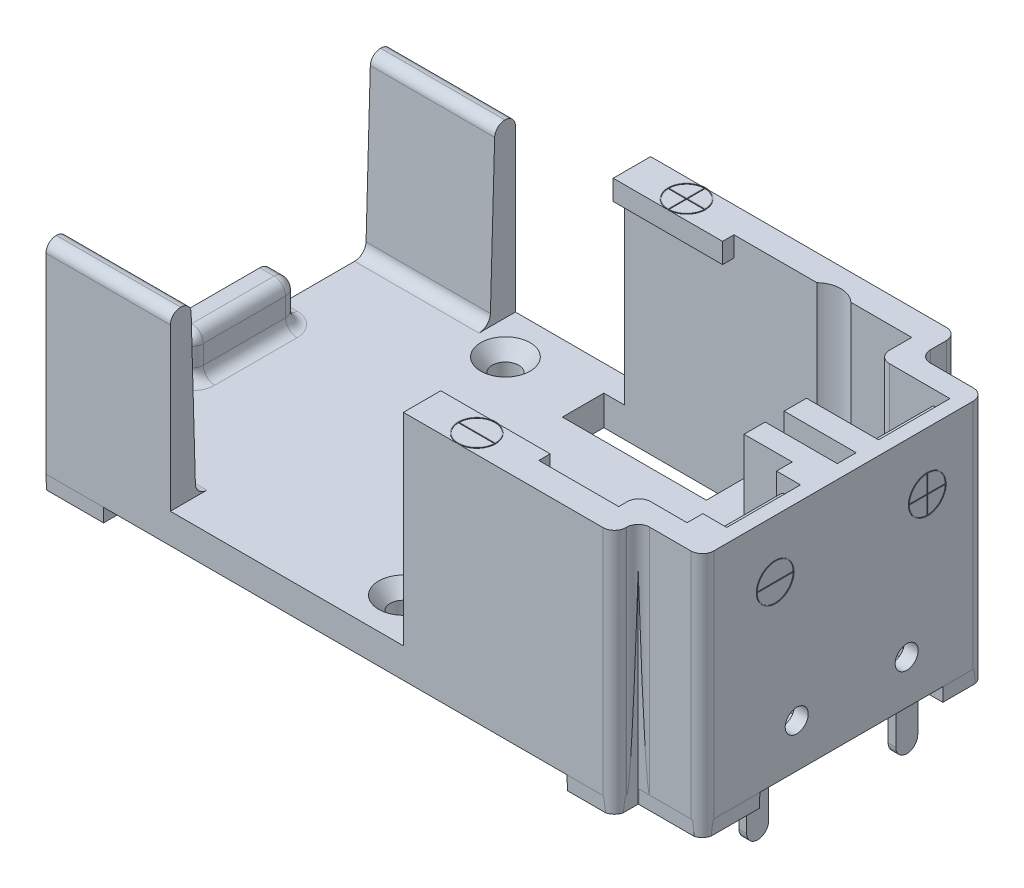
from build123d import *

# Parameters (mm, degrees)
SKETCH1_W                     = 54.94
SKETCH1_H                     = 29.97
BOSS_EXTRUDE1_DEPTH           = 20.16
SKETCH2_W                     = 5.72
SKETCH2_H                     = 3.38
SKETCH2_W_2                   = 5.57
SKETCH2_H_2                   = 2.060299425
CUT_EXTRUDE1_DEPTH            = 17.56
SKETCH6_W                     = 5.72
SKETCH6_H                     = 3.38
SKETCH6_W_2                   = 5.57
SKETCH6_H_2                   = 2.060299425
CUT_EXTRUDE3_DEPTH            = 36.881816077
BOSS_EXTRUDE5_DEPTH           = 1.2
BOSS_EXTRUDE5_DRAFT           = 1
BOSS_EXTRUDE5_PROFILE_2_DEPTH = 1.2
BOSS_EXTRUDE5_PROFILE_2_DRAFT = 1
BOSS_EXTRUDE5_PROFILE_3_DEPTH = 1.2
BOSS_EXTRUDE5_PROFILE_3_DRAFT = 1
BOSS_EXTRUDE5_PROFILE_4_DEPTH = 1.2
BOSS_EXTRUDE5_PROFILE_4_DRAFT = 1
SKETCH4_R                     = 1.9
BOSS_EXTRUDE5_PROFILE_5_DEPTH = 1.2
BOSS_EXTRUDE5_PROFILE_5_DRAFT = 1
BOSS_EXTRUDE5_PROFILE_6_DEPTH = 1.2
BOSS_EXTRUDE5_PROFILE_6_DRAFT = 1
BOSS_EXTRUDE5_PROFILE_7_DEPTH = 1.2
BOSS_EXTRUDE5_PROFILE_7_DRAFT = 1
SKETCH5_W                     = 12.5
SKETCH5_H                     = 3.6
CUT_EXTRUDE4_DEPTH            = 36.881816077
SKETCH7_W                     = 9.5
SKETCH7_H                     = 3.25
BOSS_EXTRUDE6_DEPTH           = 1.75
SKETCH8_R                     = 1.145
CUT_EXTRUDE5_DEPTH            = 38.886682687
SKETCH10_R                    = 2.14
CUT_EXTRUDE7_DEPTH            = 17.56
CHAMFER1_SIZE                 = 1
CHAMFER1_SIZE_2               = 1.191753593
BOSS_EXTRUDE7_DEPTH           = 10.8
BOSS_EXTRUDE8_DEPTH           = 2.25
FILLET1_R                     = 1
FILLET2_R                     = 1
CUT_EXTRUDE8_REACH            = 62.41
SKETCH13_R                    = 1
BOSS_EXTRUDE9_DEPTH           = 2.95
LPATTERN1_COUNT               = 2
LPATTERN1_PITCH               = 13.1
FILLET3_R                     = 1
SKETCH15_R                    = 1.625
BOSS_EXTRUDE10_DEPTH          = 0.05
SKETCH16_R                    = 1.625
BOSS_EXTRUDE11_DEPTH          = 0.05
CUT_EXTRUDE9_DEPTH            = 0.5
SKETCH18_W                    = 0.66
SKETCH18_H                    = 1.91
BOSS_EXTRUDE12_DEPTH          = 5.08
FILLET4_R                     = 0.95


with BuildPart() as part:
    # Sketch1 → Boss-Extrude1 (new body)
    with BuildSketch(Plane(origin=(0, 0, 0), x_dir=(1, 0, 0), z_dir=(0, 1, 0))):
        Rectangle(SKETCH1_W, SKETCH1_H)
    extrude(amount=BOSS_EXTRUDE1_DEPTH)

    # Sketch2 → Cut-Extrude1 (cut)
    with BuildSketch(Plane(origin=(0, 20.16, 0), x_dir=(1, 0, 0), z_dir=(0, 1, 0))):
        Polygon((24.19, -3.2), (24.19, -1.831765069), (20.01, -1.84), (20.01, 0), (26.27, 0), (26.27, 1.64), (20.01, 1.64), (20.01, 3.58), (26.27, 3.58), (26.27, 9.785), (20.01, 9.785), (20.01, 12.725), (-4.93, 12.725), (-4.93, 14.985), (-27.47, 14.985), (-27.47, -14.985), (3.57, -14.985), (3.57, -12.725), (20.01, -12.725), (20.01, -10.96), (24.19, -10.968234931), (24.19, -9.6), (26.27, -9.6), (26.27, -3.2), align=None)
        with Locations((24.61, 13.295)):
            Rectangle(SKETCH2_W, SKETCH2_H)
        with Locations((24.685, -13.954850288)):
            Rectangle(SKETCH2_W_2, SKETCH2_H_2)
    extrude(amount=-CUT_EXTRUDE1_DEPTH, mode=Mode.SUBTRACT)

    # Sketch6 → Cut-Extrude3 (cut, through all)
    with BuildSketch(Plane(origin=(0, 2.6, 0), x_dir=(1, 0, 0), z_dir=(0, 1, 0))):
        with Locations((24.61, 13.295)):
            Rectangle(SKETCH6_W, SKETCH6_H)
        with Locations((24.685, -13.954850288)):
            Rectangle(SKETCH6_W_2, SKETCH6_H_2)
    extrude(amount=-CUT_EXTRUDE3_DEPTH, mode=Mode.SUBTRACT)


with BuildPart() as boss_extrude5_tool:
    # Sketch4 → Boss-Extrude5 (with draft: the straight prism first)
    with BuildSketch(Plane.XZ):
        Polygon((20.750835959, 13.735), (20.750835959, 11.674700575), (26.22, 11.674700575), (26.22, 7.924700575), (27.47, 7.924700575), (27.47, 12.913827385), (21.950835959, 12.913827385), (21.950835959, 12.924700575), (21.9, 12.924700575), (21.9, 14.985), (17.778708036, 14.985), (17.778708036, 13.735), align=None)
    extrude(amount=BOSS_EXTRUDE5_DEPTH)
    # Boss-Extrude5: the draft: its side faces are tilted about the plane it starts from
    boss_extrude5_sides = [boss_extrude5_tool.faces().sort_by_distance(p)[0] for p in [
        (20.750835959, -0.6, 12.704850288),
        (23.485417979, -0.6, 11.674700575),
        (26.22, -0.6, 9.799700575),
        (26.845, -0.6, 7.924700575),
        (27.47, -0.6, 10.41926398),
        (24.710417979, -0.6, 12.913827385),
        (21.950835959, -0.6, 12.91926398),
        (21.925417979, -0.6, 12.924700575),
        (21.9, -0.6, 13.954850288),
        (19.839354018, -0.6, 14.985),
        (17.778708036, -0.6, 14.36),
        (19.264771997, -0.6, 13.735),
    ]]
    draft(boss_extrude5_sides, Plane.XZ, BOSS_EXTRUDE5_DRAFT)


with BuildPart() as part_1:
    add(part.part)

    # Boss-Extrude5: add boss_extrude5_tool
    add(boss_extrude5_tool.part)


with BuildPart() as boss_extrude5_profile_2_tool:
    # Sketch4 → Boss-Extrude5 profile 2 (with draft: the straight prism first)
    with BuildSketch(Plane.XZ):
        Polygon((-22.47, 13.735), (-22.47, 14.985), (-27.47, 14.985), (-27.47, 9.985), (-26.22, 9.985), (-26.22, 13.735), align=None)
    extrude(amount=BOSS_EXTRUDE5_PROFILE_2_DEPTH)
    # Boss-Extrude5 profile 2: the draft: its side faces are tilted about the plane it starts from
    boss_extrude5_profile_2_sides = [boss_extrude5_profile_2_tool.faces().sort_by_distance(p)[0] for p in [
        (-22.47, -0.6, 14.36),
        (-24.97, -0.6, 14.985),
        (-27.47, -0.6, 12.485),
        (-26.845, -0.6, 9.985),
        (-26.22, -0.6, 11.86),
        (-24.345, -0.6, 13.735),
    ]]
    draft(boss_extrude5_profile_2_sides, Plane.XZ, BOSS_EXTRUDE5_PROFILE_2_DRAFT)


with BuildPart() as part_2:
    add(part_1.part)

    # Boss-Extrude5 profile 2: add boss_extrude5_profile_2_tool
    add(boss_extrude5_profile_2_tool.part)


with BuildPart() as boss_extrude5_profile_3_tool:
    # Sketch4 → Boss-Extrude5 profile 3 (with draft: the straight prism first)
    with BuildSketch(Plane.XZ):
        Polygon((27.47, -11.605), (27.47, -7.964577097), (26.22, -7.964577097), (26.22, -10.405), (20.55, -10.405), (20.55, -13.735), (17.778708036, -13.735), (17.778708036, -14.985), (21.75, -14.985), (21.75, -11.605), align=None)
    extrude(amount=BOSS_EXTRUDE5_PROFILE_3_DEPTH)
    # Boss-Extrude5 profile 3: the draft: its side faces are tilted about the plane it starts from
    boss_extrude5_profile_3_sides = [boss_extrude5_profile_3_tool.faces().sort_by_distance(p)[0] for p in [
        (27.47, -0.6, -9.784788548),
        (26.845, -0.6, -7.964577097),
        (26.22, -0.6, -9.184788548),
        (23.385, -0.6, -10.405),
        (20.55, -0.6, -12.07),
        (19.164354018, -0.6, -13.735),
        (17.778708036, -0.6, -14.36),
        (19.764354018, -0.6, -14.985),
        (21.75, -0.6, -13.295),
        (24.61, -0.6, -11.605),
    ]]
    draft(boss_extrude5_profile_3_sides, Plane.XZ, BOSS_EXTRUDE5_PROFILE_3_DRAFT)


with BuildPart() as part_3:
    add(part_2.part)

    # Boss-Extrude5 profile 3: add boss_extrude5_profile_3_tool
    add(boss_extrude5_profile_3_tool.part)


with BuildPart() as boss_extrude5_profile_4_tool:
    # Sketch4 → Boss-Extrude5 profile 4 (with draft: the straight prism first)
    with BuildSketch(Plane.XZ):
        Polygon((-22.47, -14.985), (-22.47, -13.735), (-26.22, -13.735), (-26.22, -9.985), (-27.47, -9.985), (-27.47, -14.985), align=None)
    extrude(amount=BOSS_EXTRUDE5_PROFILE_4_DEPTH)
    # Boss-Extrude5 profile 4: the draft: its side faces are tilted about the plane it starts from
    boss_extrude5_profile_4_sides = [boss_extrude5_profile_4_tool.faces().sort_by_distance(p)[0] for p in [
        (-22.47, -0.6, -14.36),
        (-24.345, -0.6, -13.735),
        (-26.22, -0.6, -11.86),
        (-26.845, -0.6, -9.985),
        (-27.47, -0.6, -12.485),
        (-24.97, -0.6, -14.985),
    ]]
    draft(boss_extrude5_profile_4_sides, Plane.XZ, BOSS_EXTRUDE5_PROFILE_4_DRAFT)


with BuildPart() as part_4:
    add(part_3.part)

    # Boss-Extrude5 profile 4: add boss_extrude5_profile_4_tool
    add(boss_extrude5_profile_4_tool.part)


with BuildPart() as boss_extrude5_profile_5_tool:
    # Sketch4 → Boss-Extrude5 profile 5 (with draft: the straight prism first)
    with BuildSketch(Plane.XZ):
        with Locations((-0.24, 11.175)):
            Circle(SKETCH4_R)
    extrude(amount=BOSS_EXTRUDE5_PROFILE_5_DEPTH)
    # Boss-Extrude5 profile 5: the draft: its side faces are tilted about the plane it starts from
    boss_extrude5_profile_5_sides = [boss_extrude5_profile_5_tool.faces().sort_by_distance(p)[0] for p in [
        (-2.14, -0.6, 11.175),
    ]]
    draft(boss_extrude5_profile_5_sides, Plane.XZ, BOSS_EXTRUDE5_PROFILE_5_DRAFT)


with BuildPart() as part_5:
    add(part_4.part)

    # Boss-Extrude5 profile 5: add boss_extrude5_profile_5_tool
    add(boss_extrude5_profile_5_tool.part)


with BuildPart() as boss_extrude5_profile_6_tool:
    # Sketch4 → Boss-Extrude5 profile 6 (with draft: the straight prism first)
    with BuildSketch(Plane.XZ):
        with Locations((-13.7274, -11.175)):
            Circle(SKETCH4_R)
    extrude(amount=BOSS_EXTRUDE5_PROFILE_6_DEPTH)
    # Boss-Extrude5 profile 6: the draft: its side faces are tilted about the plane it starts from
    boss_extrude5_profile_6_sides = [boss_extrude5_profile_6_tool.faces().sort_by_distance(p)[0] for p in [
        (-15.6274, -0.6, -11.175),
    ]]
    draft(boss_extrude5_profile_6_sides, Plane.XZ, BOSS_EXTRUDE5_PROFILE_6_DRAFT)


with BuildPart() as part_6:
    add(part_5.part)

    # Boss-Extrude5 profile 6: add boss_extrude5_profile_6_tool
    add(boss_extrude5_profile_6_tool.part)


with BuildPart() as boss_extrude5_profile_7_tool:
    # Sketch4 → Boss-Extrude5 profile 7 (with draft: the straight prism first)
    with BuildSketch(Plane.XZ):
        with Locations((13.2474, -11.175)):
            Circle(SKETCH4_R)
    extrude(amount=BOSS_EXTRUDE5_PROFILE_7_DEPTH)
    # Boss-Extrude5 profile 7: the draft: its side faces are tilted about the plane it starts from
    boss_extrude5_profile_7_sides = [boss_extrude5_profile_7_tool.faces().sort_by_distance(p)[0] for p in [
        (11.3474, -0.6, -11.175),
    ]]
    draft(boss_extrude5_profile_7_sides, Plane.XZ, BOSS_EXTRUDE5_PROFILE_7_DRAFT)


with BuildPart() as part_7:
    add(part_6.part)

    # Boss-Extrude5 profile 7: add boss_extrude5_profile_7_tool
    add(boss_extrude5_profile_7_tool.part)

    # Sketch5 → Cut-Extrude4 (cut, through all)
    with BuildSketch(Plane(origin=(0, 2.6, 0), x_dir=(1, 0, 0), z_dir=(0, 1, 0))):
        with Locations((8.82, -10.925)):
            Rectangle(SKETCH5_W, SKETCH5_H)
        with Locations((-0.48, 10.925)):
            Rectangle(SKETCH5_W, SKETCH5_H)
    extrude(amount=-CUT_EXTRUDE4_DEPTH, mode=Mode.SUBTRACT)

    # Sketch7 → Boss-Extrude6 (add)
    with BuildSketch(Plane(origin=(0, 20.16, 0), x_dir=(1, 0, 0), z_dir=(0, 1, 0))):
        with Locations((-0.18, 13.36)):
            Rectangle(SKETCH7_W, SKETCH7_H)
        with Locations((8.32, -13.36)):
            Rectangle(SKETCH7_W, SKETCH7_H)
    extrude(amount=-BOSS_EXTRUDE6_DEPTH)

    # Sketch8 → Cut-Extrude5 (cut, through all)
    with BuildSketch(Plane.XZ.offset(1.2)):
        with Locations(Location((-0.24, 11.175, 0), (0, 0, 270))):
            Circle(SKETCH8_R)
        with Locations(Location((-13.7274, -11.175, 0), (0, 0, 270))):
            Circle(SKETCH8_R)
        with Locations(Location((13.2474, -11.175, 0), (0, 0, 270))):
            Circle(SKETCH8_R)
    extrude(amount=-CUT_EXTRUDE5_DEPTH, mode=Mode.SUBTRACT)

    # Sketch10 → Cut-Extrude7 (cut)
    with BuildSketch(Plane(origin=(0, 20.16, 0), x_dir=(1, 0, 0), z_dir=(0, 1, 0))):
        with Locations((13.2474, 11.175)):
            Circle(SKETCH10_R)
    extrude(amount=-CUT_EXTRUDE7_DEPTH, mode=Mode.SUBTRACT)

    # Chamfer1
    # the kernel refuses this chamfer: 1.191753593, 1 mm, written as the material it takes off along each edge
    with BuildSketch(Plane(origin=(-0.24, 2.6, 11.175), x_dir=(0, 0, -1), z_dir=(-1, 0, 0))) as chamfer1_piece_1:
        Polygon((1.145 + CHAMFER1_SIZE, 0), (1.145, CHAMFER1_SIZE_2), (1.145, 0), align=None)
    revolve(axis=Axis((-0.24, 2.6, 11.175), (0, -1, 0)), mode=Mode.SUBTRACT)
    with BuildSketch(Plane(origin=(13.2474, 2.6, -11.175), x_dir=(0, 0, -1), z_dir=(-1, 0, 0))) as chamfer1_piece_2_section:
        Polygon((1.145 + CHAMFER1_SIZE, 0), (1.145, CHAMFER1_SIZE_2), (1.145, 0), align=None)
    chamfer1_piece_2 = revolve(axis=Axis((13.2474, 2.6, -11.175), (0, -1, 0)), mode=Mode.PRIVATE)
    chamfer1_piece_2 = chamfer1_piece_2 & Plane(origin=(13.2474, 2.401026387, -11.175), x_dir=(1, 0, 0), z_dir=(0, 1, 0)) * Cylinder(2.14, 9, mode=Mode.PRIVATE)
    add(chamfer1_piece_2, mode=Mode.SUBTRACT)
    with BuildSketch(Plane(origin=(13.2474, 2.6, -11.175), x_dir=(0, 0, -1), z_dir=(-1, 0, 0))) as chamfer1_piece_3_section:
        Polygon((1.145 + CHAMFER1_SIZE, 0), (1.145, CHAMFER1_SIZE_2), (1.145, 0), align=None)
    chamfer1_piece_3 = revolve(axis=Axis((13.2474, 2.6, -11.175), (0, -1, 0)), mode=Mode.PRIVATE)
    chamfer1_piece_3 = split(chamfer1_piece_3, bisect_by=Plane(origin=(13.2474, 2.59813433, -12.725), z_dir=(0, 0, 1)), keep=Keep.TOP, mode=Mode.PRIVATE)
    add(chamfer1_piece_3, mode=Mode.SUBTRACT)
    with BuildSketch(Plane(origin=(-13.7274, 2.6, -11.175), x_dir=(0, 0, -1), z_dir=(-1, 0, 0))) as chamfer1_piece_4:
        Polygon((1.145 + CHAMFER1_SIZE, 0), (1.145, CHAMFER1_SIZE_2), (1.145, 0), align=None)
    revolve(axis=Axis((-13.7274, 2.6, -11.175), (0, -1, 0)), mode=Mode.SUBTRACT)

    # Sketch11 → Boss-Extrude7 (add)
    with BuildSketch(Plane.ZY.offset(27.47)):
        with BuildLine():
            Line((-14.985, 2.6), (-14.985, 16.61))
            ThreePointArc((-14.985, 16.61), (-14.724325035, 17.239325035), (-14.095, 17.5))
            Line((-14.095, 17.5), (-14.069847726, 17.5))
            ThreePointArc((-14.069847726, 17.5), (-13.449442694, 17.248120362), (-13.180200347, 16.635050779))
            Line((-13.180200347, 16.635050779), (-12.785, 2.6))
            Line((-12.785, 2.6), (-14.985, 2.6))
        make_face()
        with BuildLine():
            Line((14.985, 2.6), (14.985, 16.61))
            ThreePointArc((14.985, 16.61), (14.724325035, 17.239325035), (14.095, 17.5))
            Line((14.095, 17.5), (14.069847726, 17.5))
            ThreePointArc((14.069847726, 17.5), (13.449442694, 17.248120362), (13.180200347, 16.635050779))
            Line((13.180200347, 16.635050779), (12.785, 2.6))
            Line((12.785, 2.6), (14.985, 2.6))
        make_face()
    extrude(amount=-BOSS_EXTRUDE7_DEPTH)

    # Sketch12 → Boss-Extrude8 (add)
    with BuildSketch(Plane.ZY.offset(27.47)):
        Polygon((4.575, 2.6), (4.575, 6.23), (-4.575, 6.23), (-4.575, 2.6), (0, 2.6), align=None)
    extrude(amount=-BOSS_EXTRUDE8_DEPTH)

    # Fillet1
    fillet1_edges = [part_7.edges().sort_by_distance(p)[0] for p in [
        (-25.22, 6.23, 0),
        (-26.345, 6.23, -4.575),
        (-25.22, 4.415, 4.575),
        (-26.345, 6.23, 4.575),
        (-25.22, 2.6, 0),
        (-26.345, 2.6, 4.575),
        (-25.22, 4.415, -4.575),
        (-26.345, 2.6, -4.575),
    ]]
    fillet(fillet1_edges, radius=FILLET1_R)

    # Fillet2
    fillet2_edges = [part_7.edges().sort_by_distance(p)[0] for p in [
        (-22.07, 2.6, -12.785),
        (-22.07, 2.6, 12.785),
    ]]
    fillet(fillet2_edges, radius=FILLET2_R)

    # Sketch13 → Cut-Extrude8 (cut, up to next)
    with BuildSketch(Plane(origin=(27.47, 0, 0), x_dir=(0, 0, -1), z_dir=(1, 0, 0)), mode=Mode.PRIVATE) as cut_extrude8_sk1:
        with Locations((-4.724700575, 3.8)):
            Circle(SKETCH13_R)
    cut_extrude8_tool1 = extrude(cut_extrude8_sk1.sketch, amount=-CUT_EXTRUDE8_REACH, mode=Mode.PRIVATE) & part_7.part
    # Sketch13 → Cut-Extrude8 (cut, up to next)
    with BuildSketch(Plane(origin=(27.47, 0, 0), x_dir=(0, 0, -1), z_dir=(1, 0, 0)), mode=Mode.PRIVATE) as cut_extrude8_sk2:
        with Locations((4.825299425, 3.8)):
            Circle(SKETCH13_R)
    cut_extrude8_tool2 = extrude(cut_extrude8_sk2.sketch, amount=-CUT_EXTRUDE8_REACH, mode=Mode.PRIVATE) & part_7.part
    add(cut_extrude8_tool1.solids().sort_by_distance((27.47, 3.8, 4.724701))[0], mode=Mode.SUBTRACT)
    add(cut_extrude8_tool2.solids().sort_by_distance((27.47, 3.8, -4.825299))[0], mode=Mode.SUBTRACT)

    # Sketch14 → Boss-Extrude9 (add, symmetric)
    with BuildSketch(Plane.XY.offset(6.4)):
        with BuildLine():
            Line((20.67, 7.01), (20.67, 12.037248807))
            ThreePointArc((20.67, 12.037248807), (20.688913908, 12.173469848), (20.744224688, 12.299385))
            Line((20.744224688, 12.299385), (24.735083596, 18.781546735))
            ThreePointArc((24.735083596, 18.781546735), (24.919175941, 18.977652527), (25.17823832, 19.05))
            Line((25.17823832, 19.05), (25.77, 19.05))
            ThreePointArc((25.77, 19.05), (26.123553391, 18.903553391), (26.27, 18.55))
            Line((26.27, 18.55), (26.27, 0))
            Line((26.27, 0), (25.77, 0))
            Line((25.77, 0), (25.77, 18.55))
            Line((25.77, 18.55), (25.179691855, 18.55))
            Line((25.179691855, 18.55), (21.17, 12.037248807))
            Line((21.17, 12.037248807), (21.17, 7.01))
            Line((21.17, 7.01), (20.67, 7.01))
        make_face()
    boss_extrude9 = extrude(amount=BOSS_EXTRUDE9_DEPTH, both=True)

    # LPattern1: Boss-Extrude9 ×2
    with Locations(*[(0, 0, -i * LPATTERN1_PITCH) for i in range(1, LPATTERN1_COUNT)]):
        add(boss_extrude9)

    # Fillet3
    # the kernel refuses this fillet: 1 mm, written as the material it adds along each edge
    with BuildSketch(Plane(origin=(21.9, 20.16, 12.924700575), x_dir=(1, 0, 0), z_dir=(0, -1, 0))) as fillet3_piece_1_section:
        with BuildLine():
            CenterArc((FILLET3_R, FILLET3_R), FILLET3_R, 180, 90)
            Line((0, FILLET3_R), (0, 0))
            Line((0, 0), (FILLET3_R, 0))
        make_face()
    fillet3_piece_1 = extrude(amount=22.66, mode=Mode.PRIVATE)
    fillet3_piece_1 = split(fillet3_piece_1, bisect_by=Plane(origin=(22.363741496, 10.856251642, 13.114197153), z_dir=(0, 0.017452406437283536, -0.9998476951563913)), keep=Keep.TOP, mode=Mode.PRIVATE)
    add(fillet3_piece_1)
    with BuildSketch(Plane(origin=(21.9, 20.16, 12.924700575), x_dir=(1, 0, 0), z_dir=(0, -1, 0))) as fillet3_piece_2_section:
        with BuildLine():
            CenterArc((FILLET3_R, FILLET3_R), FILLET3_R, 180, 90)
            Line((0, FILLET3_R), (0, 0))
            Line((0, 0), (FILLET3_R, 0))
        make_face()
    fillet3_piece_2 = extrude(amount=22.66, mode=Mode.PRIVATE)
    fillet3_piece_2 = split(fillet3_piece_2, bisect_by=Plane(origin=(22.094636271, 11.150704517, 13.359044936), z_dir=(-0.9998476951563913, 0.017452406437283536, 0)), keep=Keep.TOP, mode=Mode.PRIVATE)
    add(fillet3_piece_2)
    with BuildSketch(Plane(origin=(21.75, -2.5, -11.605), x_dir=(0, 0, -1), z_dir=(0, 1, 0))) as fillet3_piece_3_section:
        with BuildLine():
            CenterArc((FILLET3_R, -FILLET3_R), FILLET3_R, 90, 90)
            Line((0, -FILLET3_R), (0, 0))
            Line((0, 0), (FILLET3_R, 0))
        make_face()
    fillet3_piece_3 = extrude(amount=22.66, mode=Mode.PRIVATE)
    fillet3_piece_3 = split(fillet3_piece_3, bisect_by=Plane(origin=(22.184344361, 11.150704517, -11.799636271), z_dir=(0, 0.017452406437283536, 0.9998476951563913)), keep=Keep.TOP, mode=Mode.PRIVATE)
    add(fillet3_piece_3)
    with BuildSketch(Plane(origin=(21.75, -2.5, -11.605), x_dir=(0, 0, -1), z_dir=(0, 1, 0))) as fillet3_piece_4_section:
        with BuildLine():
            CenterArc((FILLET3_R, -FILLET3_R), FILLET3_R, 90, 90)
            Line((0, -FILLET3_R), (0, 0))
            Line((0, 0), (FILLET3_R, 0))
        make_face()
    fillet3_piece_4 = extrude(amount=22.66, mode=Mode.PRIVATE)
    fillet3_piece_4 = split(fillet3_piece_4, bisect_by=Plane(origin=(21.944636271, 11.150704518, -12.039344361), z_dir=(-0.9998476951563913, 0.017452406437283536, 0)), keep=Keep.TOP, mode=Mode.PRIVATE)
    add(fillet3_piece_4)
    # the kernel refuses this fillet: 1 mm, written as the material it takes off along each edge
    with BuildSketch(Plane(origin=(20.01, 22.66, -9.785), x_dir=(1, 0, 0), z_dir=(0, -1, 0))) as fillet3_2_piece_1:
        with BuildLine():
            CenterArc((FILLET3_R, -FILLET3_R), FILLET3_R, 90, 90)
            Line((0, -FILLET3_R), (0, 0))
            Line((0, 0), (FILLET3_R, 0))
        make_face()
    extrude(amount=20.06, mode=Mode.SUBTRACT)
    with BuildSketch(Plane(origin=(20.01, 22.66493005, 10.96), x_dir=(0, 0, 1), z_dir=(0, -1, 0))) as fillet3_2_piece_2:
        with BuildLine():
            CenterArc((FILLET3_R * 1.00197201985, -FILLET3_R), FILLET3_R, 90, 90.11287708)
            Line((FILLET3_R * 0.00197396045284, -FILLET3_R * 1.00197007542), (0, 0))
            Line((0, 0), (FILLET3_R * 1.00197201985, 0))
        make_face()
    extrude(amount=20.06493005, mode=Mode.SUBTRACT)
    with BuildSketch(Plane(origin=(21.9, 22.66, 14.985), x_dir=(-1, 0, 0), z_dir=(0, -1, 0)), Plane(origin=(21.75, 22.66, -14.985), x_dir=(0, 0, 1), z_dir=(0, -1, 0))) as fillet3_2_piece_3:
        with BuildLine():
            CenterArc((FILLET3_R, FILLET3_R), FILLET3_R, 180, 90)
            Line((0, FILLET3_R), (0, 0))
            Line((0, 0), (FILLET3_R, 0))
        make_face()
    extrude(amount=25.16, mode=Mode.SUBTRACT)
    with BuildSketch(Plane(origin=(27.47, 22.66, 12.924700575), x_dir=(0, 0, -1), z_dir=(0, -1, 0)), Plane(origin=(27.47, -2.5, -11.605), x_dir=(0, 0, 1), z_dir=(0, 1, 0))) as fillet3_2_piece_4:
        with BuildLine():
            CenterArc((FILLET3_R, -FILLET3_R), FILLET3_R, 90, 90)
            Line((0, -FILLET3_R), (0, 0))
            Line((0, 0), (FILLET3_R, 0))
        make_face()
    extrude(amount=25.16, mode=Mode.SUBTRACT)

    # Sketch15 → Boss-Extrude10 (add)
    # profile 1 of 2: a face of its own
    with BuildSketch(Plane(origin=(0, 20.16, 0), x_dir=(1, 0, 0), z_dir=(0, 1, 0))):
        with Locations(Location((-0.18, 13.36, 0), (0, 0, 270))):
            Circle(SKETCH15_R)
        with BuildLine():
            Line((-1.754801575, 13.335), (-0.205, 13.335))
            Line((-0.205, 13.335), (-0.205, 11.785198425))
            ThreePointArc((-0.205, 11.785198425), (-1.29369318, 12.24630682), (-1.754801575, 13.335))
        make_face(mode=Mode.SUBTRACT)
        with BuildLine():
            Line((-0.205, 14.934801575), (-0.205, 13.385))
            Line((-0.205, 13.385), (-1.754801575, 13.385))
            ThreePointArc((-1.754801575, 13.385), (-1.29369318, 14.47369318), (-0.205, 14.934801575))
        make_face(mode=Mode.SUBTRACT)
        with BuildLine():
            Line((-0.155, 13.335), (1.394801575, 13.335))
            ThreePointArc((1.394801575, 13.335), (0.93369318, 12.24630682), (-0.155, 11.785198425))
            Line((-0.155, 11.785198425), (-0.155, 13.335))
        make_face(mode=Mode.SUBTRACT)
        with BuildLine():
            Line((1.394801575, 13.385), (-0.155, 13.385))
            Line((-0.155, 13.385), (-0.155, 14.934801575))
            ThreePointArc((-0.155, 14.934801575), (0.93369318, 14.47369318), (1.394801575, 13.385))
        make_face(mode=Mode.SUBTRACT)
    # profile 2 of 2: a face of its own
    with BuildSketch(Plane(origin=(0, 20.16, 0), x_dir=(1, 0, 0), z_dir=(0, 1, 0))):
        with Locations(Location((8.32, -13.36, 0), (0, 0, 270))):
            Circle(SKETCH15_R)
        with BuildLine():
            Line((6.744780809, -13.385), (9.894743767, -13.385))
            ThreePointArc((9.894743767, -13.385), (8.319762288, -14.934889961), (6.744780809, -13.385))
        make_face(mode=Mode.SUBTRACT)
        with BuildLine():
            Line((9.89475312, -13.335), (6.744771456, -13.335))
            ThreePointArc((6.744771456, -13.335), (8.319762288, -11.78452079), (9.89475312, -13.335))
        make_face(mode=Mode.SUBTRACT)
    extrude(amount=BOSS_EXTRUDE10_DEPTH)

    # Sketch16 → Boss-Extrude11 (add)
    # profile 1 of 2: a face of its own
    with BuildSketch(Plane(origin=(27.47, 0, 0), x_dir=(0, 0, -1), z_dir=(1, 0, 0))):
        with Locations((-6.604675394, 15.16)):
            Circle(SKETCH16_R)
        with BuildLine():
            Line((-5.02987382, 15.185), (-8.179476969, 15.185))
            ThreePointArc((-8.179476969, 15.185), (-7.718368575, 16.27369318), (-6.629675394, 16.734801575))
            Line((-6.629675394, 16.734801575), (-6.579675394, 16.734801575))
            ThreePointArc((-6.579675394, 16.734801575), (-5.490982214, 16.27369318), (-5.02987382, 15.185))
        make_face(mode=Mode.SUBTRACT)
        with BuildLine():
            ThreePointArc((-5.02987382, 15.135), (-5.490982214, 14.04630682), (-6.579675394, 13.585198425))
            Line((-6.579675394, 13.585198425), (-6.629675394, 13.585198425))
            ThreePointArc((-6.629675394, 13.585198425), (-7.718368575, 14.04630682), (-8.179476969, 15.135))
            Line((-8.179476969, 15.135), (-5.02987382, 15.135))
        make_face(mode=Mode.SUBTRACT)
    # profile 2 of 2: a face of its own
    with BuildSketch(Plane(origin=(27.47, 0, 0), x_dir=(0, 0, -1), z_dir=(1, 0, 0))):
        with Locations(Location((6.604675394, 15.16, 0), (0, 0, 180))):
            Circle(SKETCH16_R)
        with BuildLine():
            Line((6.579675394, 16.734801575), (6.579675394, 15.185))
            Line((6.579675394, 15.185), (5.02987382, 15.185))
            ThreePointArc((5.02987382, 15.185), (5.490982214, 16.27369318), (6.579675394, 16.734801575))
        make_face(mode=Mode.SUBTRACT)
        with BuildLine():
            Line((8.179476969, 15.185), (6.629675394, 15.185))
            Line((6.629675394, 15.185), (6.629675394, 16.734801575))
            ThreePointArc((6.629675394, 16.734801575), (7.718368575, 16.27369318), (8.179476969, 15.185))
        make_face(mode=Mode.SUBTRACT)
        with BuildLine():
            ThreePointArc((8.179476969, 15.135), (7.718368575, 14.04630682), (6.629675394, 13.585198425))
            Line((6.629675394, 13.585198425), (6.629675394, 15.135))
            Line((6.629675394, 15.135), (8.179476969, 15.135))
        make_face(mode=Mode.SUBTRACT)
        with BuildLine():
            Line((5.02987382, 15.135), (6.579675394, 15.135))
            Line((6.579675394, 15.135), (6.579675394, 13.585198425))
            ThreePointArc((6.579675394, 13.585198425), (5.490982214, 14.04630682), (5.02987382, 15.135))
        make_face(mode=Mode.SUBTRACT)
    extrude(amount=BOSS_EXTRUDE11_DEPTH)

    # Sketch17 → Cut-Extrude9 (cut)
    with BuildSketch(Plane.ZY.offset(-25.77)):
        with BuildLine():
            Line((7.4, 2.6), (7.4, 4.1))
            ThreePointArc((7.4, 4.1), (7.546446609, 4.453553391), (7.9, 4.6))
            Line((7.9, 4.6), (9.35, 4.6))
            Line((9.35, 4.6), (9.35, 2.6))
            Line((9.35, 2.6), (7.4, 2.6))
        make_face()
        with BuildLine():
            Line((5.4, 2.6), (5.4, 4.1))
            ThreePointArc((5.4, 4.1), (5.253553391, 4.453553391), (4.9, 4.6))
            Line((4.9, 4.6), (3.45, 4.6))
            Line((3.45, 4.6), (3.45, 2.6))
            Line((3.45, 2.6), (5.4, 2.6))
        make_face()
        with BuildLine():
            Line((-3.75, 4.6), (-5.2, 4.6))
            ThreePointArc((-5.2, 4.6), (-5.553553391, 4.453553391), (-5.7, 4.1))
            Line((-5.7, 4.1), (-5.7, 2.6))
            Line((-5.7, 2.6), (-3.75, 2.6))
            Line((-3.75, 2.6), (-3.75, 4.6))
        make_face()
        with BuildLine():
            Line((-7.7, 2.6), (-7.7, 4.1))
            ThreePointArc((-7.7, 4.1), (-7.846446609, 4.453553391), (-8.2, 4.6))
            Line((-8.2, 4.6), (-9.65, 4.6))
            Line((-9.65, 4.6), (-9.65, 2.6))
            Line((-9.65, 2.6), (-7.7, 2.6))
        make_face()
    extrude(amount=-CUT_EXTRUDE9_DEPTH, mode=Mode.SUBTRACT)

    # Sketch18 → Boss-Extrude12 (add)
    with BuildSketch(Plane.XZ):
        with Locations((25.5374, -6.435)):
            Rectangle(SKETCH18_W, SKETCH18_H)
        with Locations((25.5374, 6.515)):
            Rectangle(SKETCH18_W, SKETCH18_H)
    extrude(amount=BOSS_EXTRUDE12_DEPTH)

    # Fillet4
    fillet4_edges = [part_7.edges().sort_by_distance(p)[0] for p in [
        (25.5374, -5.08, 5.56),
        (25.5374, -5.08, 7.47),
        (25.5374, -5.08, -5.48),
        (25.5374, -5.08, -7.39),
    ]]
    fillet(fillet4_edges, radius=FILLET4_R)


solid = part_7.part
